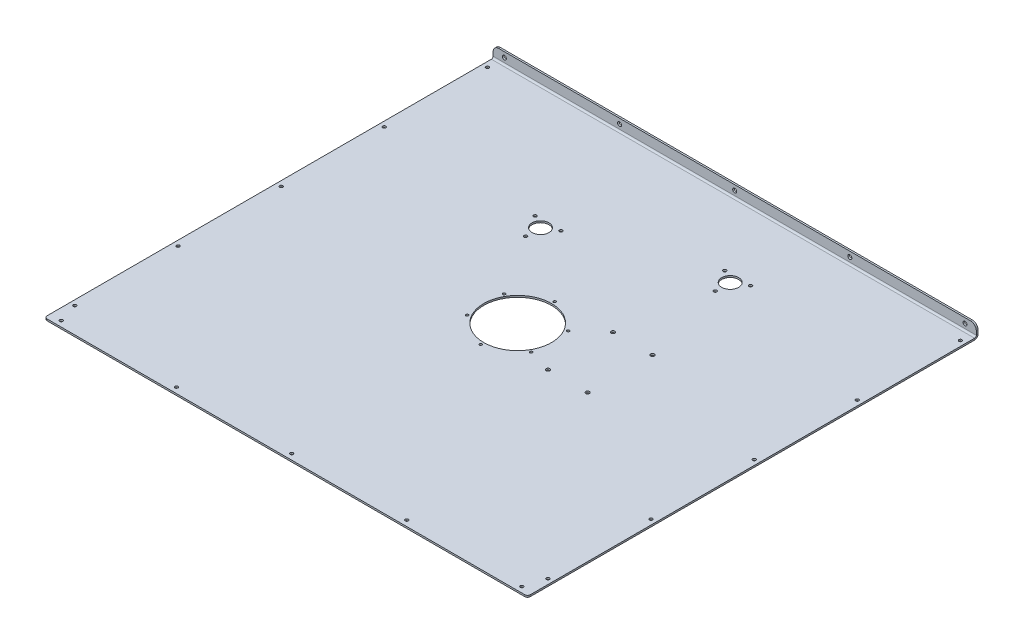
from build123d import *

# Parameters (mm, degrees)
SKETCH1_W                    = 856
SKETCH1_H                    = 798
BASE_FLANGE1_DEPTH           = 3
SKETCH8_R                    = 60
CUT_EXTRUDE1_DEPTH           = 3
M4_CLEARANCE_HOLE1_D         = 4.5
CIRPATTERN1_COUNT            = 6
EDGE_FLANGE1_STRIP_W         = 18
EDGE_FLANGE1_STRIP_H         = 3
EDGE_FLANGE1_STRIP_CUT_DEPTH = 856
EDGE_FLANGE1_DEPTH           = 856
M5_CLEARANCE_HOLE3_D         = 5.5
M5_CLEARANCE_HOLE4_D         = 5.5
LPATTERN1_COUNT              = 5
LPATTERN1_PITCH              = 204
F_7_1_7_1_DIAMETER_HOLE1_D   = 7.1
LPATTERN2_COUNT              = 5
LPATTERN2_PITCH              = 204
SKETCH26_R                   = 15
CUT_EXTRUDE2_DEPTH           = 3
M5_CLEARANCE_HOLE6_D         = 5.5
FILLET1_R                    = 5
FILLET2_R                    = 10
SKETCH29_R                   = 15
CUT_EXTRUDE3_DEPTH           = 10
M5_CLEARANCE_HOLE7_D         = 5.5
CIRPATTERN2_COUNT            = 3
M6_CLEARANCE_HOLE1_D         = 6.6


# Sheet-metal steps are written as plain solids
with BuildPart() as part:
    # Sketch1 → Base-Flange1 (new body)
    with BuildSketch(Plane(origin=(0, 0, 0), x_dir=(1, 0, 0), z_dir=(0, 1, 0))):
        with Locations((0, -11.5)):
            Rectangle(SKETCH1_W, SKETCH1_H)
    extrude(amount=-BASE_FLANGE1_DEPTH)

    # Sketch8 → Cut-Extrude1 (cut)
    with BuildSketch(Plane(origin=(0, 0, 0), x_dir=(1, 0, 0), z_dir=(0, 1, 0))):
        with Locations(Location((0, 0, 0), (0, 0, 270))):
            Circle(SKETCH8_R)
    extrude(amount=-CUT_EXTRUDE1_DEPTH, mode=Mode.SUBTRACT)

    # M4 Clearance Hole1 (through all)
    with Locations(Plane(origin=(0, -3, 0), x_dir=(-1, 0, 0), z_dir=(0, -1, 0))):
        with Locations((56.724663948, 32.75)):
            m4_clearance_hole1 = Hole(M4_CLEARANCE_HOLE1_D / 2)

    # CirPattern1: M4 Clearance Hole1 ×6 about axis
    cirpattern1_axis = Axis((0, 0, 0), (0, 1, 0))
    for i in range(1, CIRPATTERN1_COUNT):
        add(m4_clearance_hole1.rotate(cirpattern1_axis, i * 360 / CIRPATTERN1_COUNT), mode=Mode.SUBTRACT)

    # Edge-Flange1 strip (across the edge) → Edge-Flange1 strip cut (cut)
    with BuildSketch(Plane(origin=(428, 0, -387.5), x_dir=(0, 0, 1), z_dir=(-1, 0, 0))):
        with Locations((-3, -1.5)):
            Rectangle(EDGE_FLANGE1_STRIP_W, EDGE_FLANGE1_STRIP_H)
    extrude(amount=EDGE_FLANGE1_STRIP_CUT_DEPTH, mode=Mode.SUBTRACT)

    # Edge-Flange1 section (across the edge) → Edge-Flange1 (add)
    with BuildSketch(Plane(origin=(428, 0, -387.5), x_dir=(0, 0, 1), z_dir=(-1, 0, 0))):
        with BuildLine():
            Line((0, 3), (0, 20))
            Line((0, 20), (3, 20))
            Line((3, 20), (3, 3))
            ThreePointArc((3, 3), (3.878679656, 0.878679656), (6, 0))
            Line((6, 0), (6, -3))
            ThreePointArc((6, -3), (1.757359313, -1.242640687), (0, 3))
        make_face()
    extrude(amount=EDGE_FLANGE1_DEPTH)

    # M5 Clearance Hole3 (through all)
    with Locations(Plane(origin=(0, -3, 0), x_dir=(-1, 0, 0), z_dir=(0, -1, 0))):
        with Locations((419, 365.4), (419, 182.7), (419, 0), (419, -182.7), (419, -365.4)):
            m5_clearance_hole3 = Hole(M5_CLEARANCE_HOLE3_D / 2)

    # Mirror2: M5 Clearance Hole3 across plane
    add(m5_clearance_hole3.mirror(Plane(origin=(0, 0, 0), x_dir=(0, 0, 1), z_dir=(1, 0, 0))), mode=Mode.SUBTRACT)

    # M5 Clearance Hole4 (through all)
    with Locations(Plane(origin=(0, 0, 0), x_dir=(1, 0, 0), z_dir=(0, 1, 0))):
        with Locations((-408, -400.5)):
            m5_clearance_hole4 = Hole(M5_CLEARANCE_HOLE4_D / 2)

    # LPattern1: M5 Clearance Hole4 ×5
    with Locations(*[(i * LPATTERN1_PITCH, 0, 0) for i in range(1, LPATTERN1_COUNT)]):
        add(m5_clearance_hole4, mode=Mode.SUBTRACT)

    # Ø7.1 (7.1) Diameter Hole1 (through all)
    with Locations(Plane.XY.offset(-384.5)):
        with Locations((-408, 11)):
            f_7_1_7_1_diameter_hole1 = Hole(F_7_1_7_1_DIAMETER_HOLE1_D / 2)

    # LPattern2: Ø7.1 (7.1) Diameter Hole1 ×5
    with Locations(*[(i * LPATTERN2_PITCH, 0, 0) for i in range(1, LPATTERN2_COUNT)]):
        add(f_7_1_7_1_diameter_hole1, mode=Mode.SUBTRACT)

    # Sketch26 → Cut-Extrude2 (cut)
    with BuildSketch(Plane(origin=(0, -3, 0), x_dir=(-1, 0, 0), z_dir=(0, -1, 0))):
        with Locations(Location((126.0075, 166.500832071, 0), (0, 0, 90))):
            Circle(SKETCH26_R)
    extrude(amount=-CUT_EXTRUDE2_DEPTH, mode=Mode.SUBTRACT)

    # M5 Clearance Hole6 (through all)
    with Locations(Plane(origin=(0, -3, 0), x_dir=(-1, 0, 0), z_dir=(0, -1, 0))):
        with Locations((148.87057066, 179.700832071), (126.0075, 140.100832071), (103.14442934, 179.700832071)):
            Hole(M5_CLEARANCE_HOLE6_D / 2)

    # Fillet1
    fillet1_edges = [part.edges().sort_by_distance(p)[0] for p in [
        (428, -1.5, 410.5),
        (-428, -1.5, 410.5),
    ]]
    fillet(fillet1_edges, radius=FILLET1_R)

    # Fillet2
    fillet2_edges = [part.edges().sort_by_distance(p)[0] for p in [
        (428, 20, -386),
        (-428, 20, -386),
    ]]
    fillet(fillet2_edges, radius=FILLET2_R)

    # Sketch29 → Cut-Extrude3 (cut)
    with BuildSketch(Plane(origin=(0, 0, 0), x_dir=(1, 0, 0), z_dir=(0, 1, 0))):
        with Locations(Location((126, 250.500832071, 0), (0, 0, 270))):
            Circle(SKETCH29_R)
    extrude(amount=-CUT_EXTRUDE3_DEPTH, mode=Mode.SUBTRACT)

    # M5 Clearance Hole7 (through all)
    with Locations(Plane(origin=(0, 0, 0), x_dir=(1, 0, 0), z_dir=(0, 1, 0))):
        with Locations((126, 224.000832071)):
            m5_clearance_hole7 = Hole(M5_CLEARANCE_HOLE7_D / 2)

    # CirPattern2: M5 Clearance Hole7 ×3 about axis
    cirpattern2_axis = Axis((126, 0, -250.500832071), (0, 1, 0))
    for i in range(1, CIRPATTERN2_COUNT):
        add(m5_clearance_hole7.rotate(cirpattern2_axis, i * 360 / CIRPATTERN2_COUNT), mode=Mode.SUBTRACT)

    # M6 Clearance Hole1 (through all)
    with Locations(Plane(origin=(0, 0, 0), x_dir=(1, 0, 0), z_dir=(0, 1, 0))):
        with Locations((98.5, -44.65), (168.5, -44.65), (168.5, 70.35), (98.5, 70.35)):
            Hole(M6_CLEARANCE_HOLE1_D / 2)


solid = part.part
